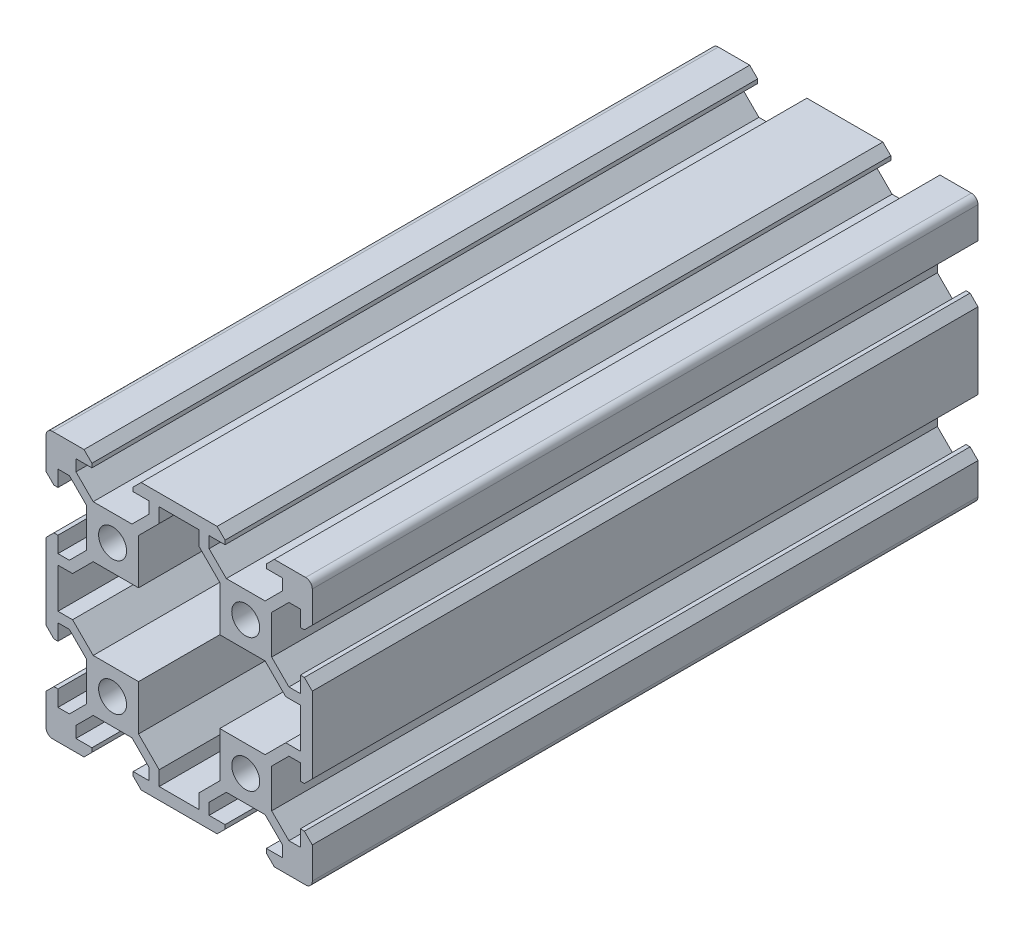
from build123d import *

# Parameters (mm, degrees)
SKETCH_1_R      = 2.1
EXTRUDE_1_DEPTH = 100
VERRUNDUNG1_R   = 1


with BuildPart() as part:
    # 草图1 → 凸台-拉伸1 (new body)
    with BuildSketch(Plane.XY):
        Polygon((5.71, 20), (-5.71, 20), (-6.9, 18.81), (-6.9, 18.2), (-4.5, 18.2), (-4.5, 16.489949494), (-7.089949494, 13.9), (-12.910050506, 13.9), (-15.5, 16.489949494), (-15.5, 18.2), (-13.1, 18.2), (-13.1, 18.81), (-14.29, 20), (-20, 20), (-20, 14.29), (-18.81, 13.1), (-18.2, 13.1), (-18.2, 15.5), (-16.489949494, 15.5), (-13.9, 12.910050506), (-13.9, 7.089949494), (-16.489949494, 4.5), (-18.2, 4.5), (-18.2, 6.9), (-18.81, 6.9), (-20, 5.71), (-20, -5.71), (-18.81, -6.9), (-18.2, -6.9), (-18.2, -4.5), (-16.489949494, -4.5), (-13.9, -7.089949494), (-13.9, -12.910050506), (-16.489949494, -15.5), (-18.2, -15.5), (-18.2, -13.1), (-18.81, -13.1), (-20, -14.29), (-20, -20), (-14.29, -20), (-13.1, -18.81), (-13.1, -18.2), (-15.5, -18.2), (-15.5, -16.489949494), (-12.910050506, -13.9), (-7.089949494, -13.9), (-4.5, -16.489949494), (-4.5, -18.2), (-6.9, -18.2), (-6.9, -18.81), (-5.71, -20), (5.71, -20), (6.9, -18.81), (6.9, -18.2), (4.5, -18.2), (4.5, -16.489949494), (7.089949494, -13.9), (12.910050506, -13.9), (15.5, -16.489949494), (15.5, -18.2), (13.1, -18.2), (13.1, -18.81), (14.29, -20), (20, -20), (20, -14.29), (18.81, -13.1), (18.2, -13.1), (18.2, -15.5), (16.489949494, -15.5), (13.9, -12.910050506), (13.9, -7.089949494), (16.489949494, -4.5), (18.2, -4.5), (18.2, -6.9), (18.81, -6.9), (20, -5.71), (20, 5.71), (18.81, 6.9), (18.2, 6.9), (18.2, 4.5), (16.489949494, 4.5), (13.9, 7.089949494), (13.9, 12.910050506), (16.489949494, 15.5), (18.2, 15.5), (18.2, 13.1), (18.81, 13.1), (20, 14.29), (20, 20), (14.29, 20), (13.1, 18.81), (13.1, 18.2), (15.5, 18.2), (15.5, 16.489949494), (12.910050506, 13.9), (7.089949494, 13.9), (4.5, 16.489949494), (4.5, 18.2), (6.9, 18.2), (6.9, 18.81), align=None)
        with Locations((-10, 10)):
            Circle(SKETCH_1_R, mode=Mode.SUBTRACT)
        with Locations((-10, -10)):
            Circle(SKETCH_1_R, mode=Mode.SUBTRACT)
        with Locations((10, -10)):
            Circle(SKETCH_1_R, mode=Mode.SUBTRACT)
        with Locations((10, 10)):
            Circle(SKETCH_1_R, mode=Mode.SUBTRACT)
        Polygon((-6.1, 6.1), (-6.1, 12.910050506), (-3, 16.010050506), (-3, 18.2), (3, 18.2), (3, 16.010050506), (6.1, 12.910050506), (6.1, 6.1), (12.910050506, 6.1), (16.010050506, 3), (18.2, 3), (18.2, -3), (16.010050506, -3), (12.910050506, -6.1), (6.1, -6.1), (6.1, -12.910050506), (3, -16.010050506), (3, -18.2), (-3, -18.2), (-3, -16.010050506), (-6.1, -12.910050506), (-6.1, -6.1), (-12.910050506, -6.1), (-16.010050506, -3), (-18.2, -3), (-18.2, 3), (-16.010050506, 3), (-12.910050506, 6.1), align=None, mode=Mode.SUBTRACT)
    extrude(amount=EXTRUDE_1_DEPTH)

    # Verrundung1
    verrundung1_edges = [part.edges().sort_by_distance(p)[0] for p in [
        (20, -20, 50),
        (-20, -20, 50),
        (-20, 20, 50),
        (20, 20, 50),
    ]]
    fillet(verrundung1_edges, radius=VERRUNDUNG1_R)


solid = part.part
